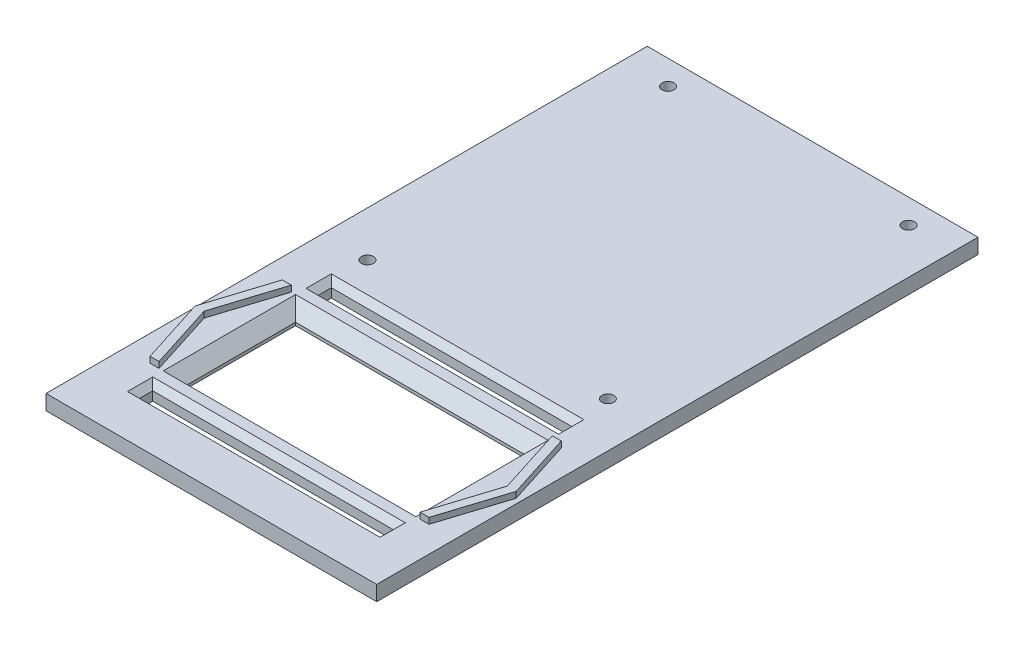
from build123d import *

# Parameters (mm, degrees)
SKETCH1_W           = 139.7
SKETCH1_H           = 254
BOSS_EXTRUDE1_DEPTH = 6.35
SKETCH2_W           = 96.52
SKETCH2_H           = 45.72
MAIN_HOLE_DEPTH     = 240.117763874
SKETCH3_W           = 101.6
SKETCH3_H           = 5.588
NEOPIXEL_DEPTH      = 240.117763874
CHAMFER1_SIZE       = 2.54
CHAMFER2_SIZE       = 5.08
CUT_EXTRUDE1_REACH  = 241.118
SKETCH7_R           = 2.54
BOSS_EXTRUDE4_DEPTH = 2.54


with BuildPart() as part:
    # Sketch1 → Boss-Extrude1 (new body)
    with BuildSketch(Plane(origin=(0, 0, 0), x_dir=(1, 0, 0), z_dir=(0, 1, 0))):
        with Locations((0, 101.6)):
            Rectangle(SKETCH1_W, SKETCH1_H)
    extrude(amount=BOSS_EXTRUDE1_DEPTH)

    # Sketch2 → Main Hole (cut, through all)
    with BuildSketch(Plane(origin=(0, 6.35, 0), x_dir=(1, 0, 0), z_dir=(0, 1, 0))):
        with Locations((0, 35.56)):
            Rectangle(SKETCH2_W, SKETCH2_H)
    extrude(amount=-MAIN_HOLE_DEPTH, mode=Mode.SUBTRACT)

    # Sketch3 → NeoPixel (cut, through all)
    with BuildSketch(Plane(origin=(0, 6.35, 0), x_dir=(1, 0, 0), z_dir=(0, 1, 0))):
        with Locations((0, 73.279)):
            Rectangle(SKETCH3_W, SKETCH3_H)
    neopixel = extrude(amount=-NEOPIXEL_DEPTH, mode=Mode.SUBTRACT)

    # Mirror2: NeoPixel across plane
    add(neopixel.mirror(Plane.XY.offset(-35.56)), mode=Mode.SUBTRACT)

    # Chamfer1
    chamfer1_edges = [part.edges().sort_by_distance(p)[0] for p in [
        (50.8, 6.35, 2.159),
        (0, 6.35, 4.953),
        (-50.8, 6.35, 2.159),
        (0, 6.35, -0.635),
        (-50.8, 6.35, -73.279),
        (0, 6.35, -70.485),
        (50.8, 6.35, -73.279),
        (0, 6.35, -76.073),
    ]]
    chamfer(chamfer1_edges, length=CHAMFER1_SIZE)

    # Chamfer2
    chamfer2_edges = [part.edges().sort_by_distance(p)[0] for p in [
        (48.26, 6.35, -35.56),
        (0, 6.35, -12.7),
        (-48.26, 6.35, -35.56),
        (0, 6.35, -58.42),
    ]]
    chamfer(chamfer2_edges, length=CHAMFER2_SIZE)

    # Sketch7 → Cut-Extrude1 (cut, up to next)
    with BuildSketch(Plane(origin=(0, 6.35, 0), x_dir=(1, 0, 0), z_dir=(0, 1, 0)), mode=Mode.PRIVATE) as cut_extrude1_sk1:
        with Locations((50.8, 91.313)):
            Circle(SKETCH7_R)
    cut_extrude1_tool1 = extrude(cut_extrude1_sk1.sketch, amount=-CUT_EXTRUDE1_REACH, mode=Mode.PRIVATE) & part.part
    # Sketch7 → Cut-Extrude1 (cut, up to next)
    with BuildSketch(Plane(origin=(0, 6.35, 0), x_dir=(1, 0, 0), z_dir=(0, 1, 0)), mode=Mode.PRIVATE) as cut_extrude1_sk2:
        with Locations((-50.8, 91.313)):
            Circle(SKETCH7_R)
    cut_extrude1_tool2 = extrude(cut_extrude1_sk2.sketch, amount=-CUT_EXTRUDE1_REACH, mode=Mode.PRIVATE) & part.part
    # Sketch7 → Cut-Extrude1 (cut, up to next)
    with BuildSketch(Plane(origin=(0, 6.35, 0), x_dir=(1, 0, 0), z_dir=(0, 1, 0)), mode=Mode.PRIVATE) as cut_extrude1_sk3:
        with Locations((-50.8, 218.313)):
            Circle(SKETCH7_R)
    cut_extrude1_tool3 = extrude(cut_extrude1_sk3.sketch, amount=-CUT_EXTRUDE1_REACH, mode=Mode.PRIVATE) & part.part
    # Sketch7 → Cut-Extrude1 (cut, up to next)
    with BuildSketch(Plane(origin=(0, 6.35, 0), x_dir=(1, 0, 0), z_dir=(0, 1, 0)), mode=Mode.PRIVATE) as cut_extrude1_sk4:
        with Locations((50.8, 218.313)):
            Circle(SKETCH7_R)
    cut_extrude1_tool4 = extrude(cut_extrude1_sk4.sketch, amount=-CUT_EXTRUDE1_REACH, mode=Mode.PRIVATE) & part.part
    add(cut_extrude1_tool1.solids().sort_by_distance((50.8, 6.35, -91.313))[0], mode=Mode.SUBTRACT)
    add(cut_extrude1_tool2.solids().sort_by_distance((-50.8, 6.35, -91.313))[0], mode=Mode.SUBTRACT)
    add(cut_extrude1_tool3.solids().sort_by_distance((-50.8, 6.35, -218.313))[0], mode=Mode.SUBTRACT)
    add(cut_extrude1_tool4.solids().sort_by_distance((50.8, 6.35, -218.313))[0], mode=Mode.SUBTRACT)

    # Sketch8 → Boss-Extrude4 (add)
    with BuildSketch(Plane(origin=(0, 6.35, 0), x_dir=(1, 0, 0), z_dir=(0, 1, 0))):
        Polygon((58.928, 63.5), (67.818, 35.56), (58.928, 7.62), (55.118, 7.62), (64.008, 35.56), (55.118, 63.5), align=None)
    boss_extrude4 = extrude(amount=BOSS_EXTRUDE4_DEPTH)

    # Mirror3: Boss-Extrude4 across plane
    add(boss_extrude4.mirror(Plane(origin=(0, 0, 0), x_dir=(0, 0, 1), z_dir=(1, 0, 0))))


solid = part.part
